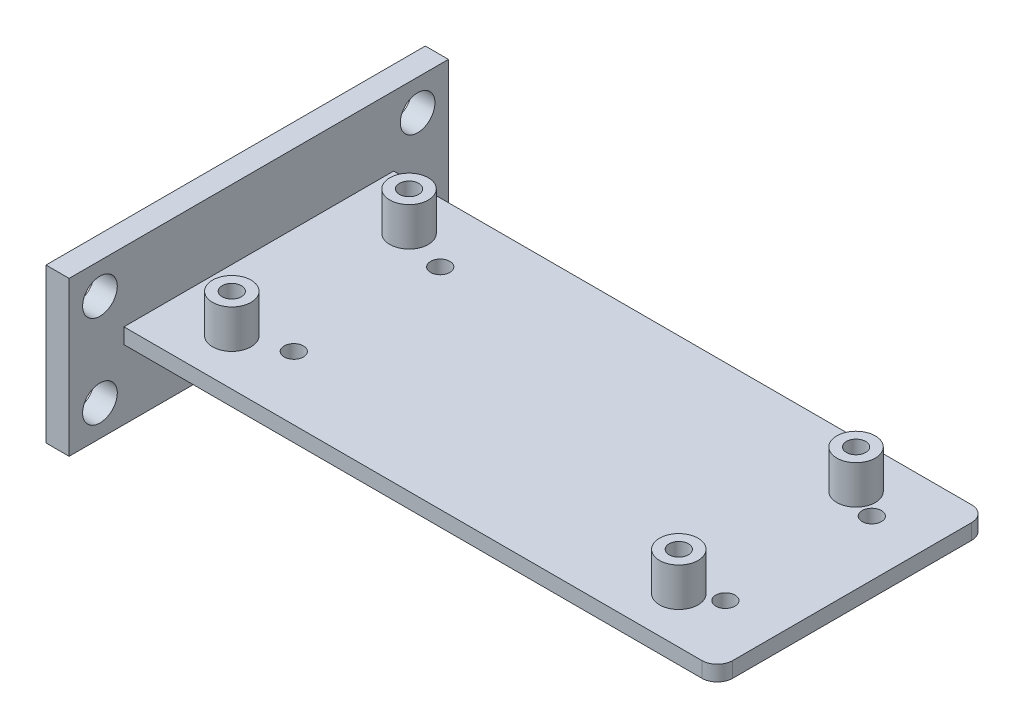
from build123d import *

# Parameters (mm, degrees)
SKETCH_1_W               = 80
SKETCH_1_H               = 35
EXTRUDE_1_DEPTH          = 2
SKETCH_2_R               = 2.5
EXTRUDE_2_DEPTH          = 5
CUT_EXTRUDE_1_DEPTH      = 88.601369852
CUT_EXTRUDE_1_DEPTH_BACK = 88.601369852
SKETCH_3_R               = 1.25
FILLET_1_R               = 2
FILLET_2_R               = 2
FILLET_3_R               = 2
FILLET_4_R               = 2
SKETCH_5_R               = 1.25
CUT_EXTRUDE_3_DEPTH      = 10
EXTRUDE_START            = 4
SKETCH_6_R               = 2.5
SKETCH_6_R_2             = 1.25
EXTRUDE_3_DEPTH          = 4
SKETCH_7_W               = 49.218742156
SKETCH_7_H               = 20
SKETCH_7_R               = 2.25
EXTRUDE_4_DEPTH          = 3


with BuildPart() as part:
    # Эскиз1 → Бобышка-Вытянуть1 (new body)
    with BuildSketch(Plane(origin=(0, 0, 0), x_dir=(1, 0, 0), z_dir=(0, 1, 0))):
        with Locations((40, -17.5)):
            Rectangle(SKETCH_1_W, SKETCH_1_H)
    extrude(amount=EXTRUDE_1_DEPTH)

    # Эскиз2 → Бобышка-Вытянуть2 (add)
    with BuildSketch(Plane(origin=(0, 2, 0), x_dir=(1, 0, 0), z_dir=(0, 1, 0))):
        with Locations((11, -6)):
            Circle(SKETCH_2_R)
        with Locations((11, -29)):
            Circle(SKETCH_2_R)
        with Locations((69, -6)):
            Circle(SKETCH_2_R)
        with Locations((69, -29)):
            Circle(SKETCH_2_R)
    extrude(amount=EXTRUDE_2_DEPTH)

    # Эскиз3 → Вырез-Вытянуть1 (cut, two sides: drawn at the far end of the back side and taken through both)
    with BuildSketch(Plane(origin=(0, 7, 0), x_dir=(1, 0, 0), z_dir=(0, 1, 0)).offset(-CUT_EXTRUDE_1_DEPTH_BACK)):
        with Locations((11, -6)):
            Circle(SKETCH_3_R)
        with Locations((11, -29)):
            Circle(SKETCH_3_R)
        with Locations((69, -6)):
            Circle(SKETCH_3_R)
        with Locations((69, -29)):
            Circle(SKETCH_3_R)
    extrude(amount=CUT_EXTRUDE_1_DEPTH + CUT_EXTRUDE_1_DEPTH_BACK, mode=Mode.SUBTRACT)

    # Скругление1
    fillet_1_edges = [part.edges().sort_by_distance(p)[0] for p in [
        (0, 1, 0),
    ]]
    fillet(fillet_1_edges, radius=FILLET_1_R)

    # Скругление2
    fillet_2_edges = [part.edges().sort_by_distance(p)[0] for p in [
        (0, 1, 35),
    ]]
    fillet(fillet_2_edges, radius=FILLET_2_R)

    # Скругление3
    fillet_3_edges = [part.edges().sort_by_distance(p)[0] for p in [
        (80, 1, 35),
    ]]
    fillet(fillet_3_edges, radius=FILLET_3_R)

    # Скругление4
    fillet_4_edges = [part.edges().sort_by_distance(p)[0] for p in [
        (80, 1, 0),
    ]]
    fillet(fillet_4_edges, radius=FILLET_4_R)

    # Эскиз5 → Вырез-Вытянуть3 (cut)
    with BuildSketch(Plane.XZ):
        with Locations((16.789329721, 26.745983075)):
            Circle(SKETCH_5_R)
        with Locations((72.789329721, 26.745983075)):
            Circle(SKETCH_5_R)
        with Locations((72.789329721, 7.745983075)):
            Circle(SKETCH_5_R)
        with Locations((16.789329721, 7.745983075)):
            Circle(SKETCH_5_R)
    extrude(amount=-CUT_EXTRUDE_3_DEPTH, mode=Mode.SUBTRACT)

    # Эскиз6 → Бобышка-Вытянуть3 (add)
    # profile 1 of 4: a face of its own
    with BuildSketch(Plane.XZ.offset(EXTRUDE_START)):
        with Locations((16.789329721, 26.745983075)):
            Circle(SKETCH_6_R)
        with Locations((16.789329721, 26.745983075)):
            Circle(SKETCH_6_R_2, mode=Mode.SUBTRACT)
    # profile 2 of 4: a face of its own
    with BuildSketch(Plane.XZ.offset(EXTRUDE_START)):
        with Locations((72.789329721, 26.745983075)):
            Circle(SKETCH_6_R)
        with Locations((72.789329721, 26.745983075)):
            Circle(SKETCH_6_R_2, mode=Mode.SUBTRACT)
    # profile 3 of 4: a face of its own
    with BuildSketch(Plane.XZ.offset(EXTRUDE_START)):
        with Locations((72.789329721, 7.745983075)):
            Circle(SKETCH_6_R)
        with Locations((72.789329721, 7.745983075)):
            Circle(SKETCH_6_R_2, mode=Mode.SUBTRACT)
    # profile 4 of 4: a face of its own
    with BuildSketch(Plane.XZ.offset(EXTRUDE_START)):
        with Locations((16.789329721, 7.745983075)):
            Circle(SKETCH_6_R)
        with Locations((16.789329721, 7.745983075)):
            Circle(SKETCH_6_R_2, mode=Mode.SUBTRACT)
    extrude(amount=-EXTRUDE_3_DEPTH)

    # Эскиз7 → Бобышка-Вытянуть4 (add)
    with BuildSketch(Plane.ZY):
        with Locations((17.5, 1)):
            Rectangle(SKETCH_7_W, SKETCH_7_H)
        with Locations((38.109371078, -5)):
            Circle(SKETCH_7_R, mode=Mode.SUBTRACT)
        with Locations((-3.109371078, -5)):
            Circle(SKETCH_7_R, mode=Mode.SUBTRACT)
        with Locations((-3.109371078, 7)):
            Circle(SKETCH_7_R, mode=Mode.SUBTRACT)
        with Locations((38.109371078, 7)):
            Circle(SKETCH_7_R, mode=Mode.SUBTRACT)
    extrude(amount=-EXTRUDE_4_DEPTH)


solid = part.part
